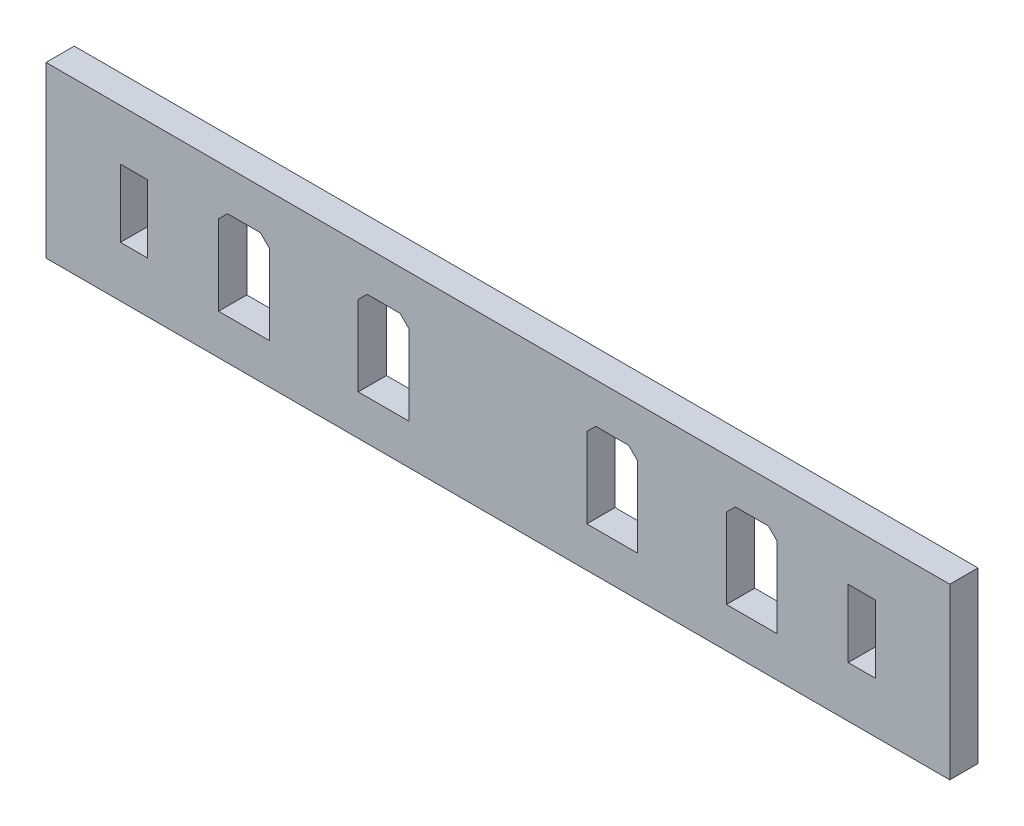
from build123d import *

# Parameters (mm, degrees)
SKETCH1_W           = 101.6
SKETCH1_H           = 19.05
BOSS_EXTRUDE1_DEPTH = 3.175
SKETCH2_W           = 3.048
SKETCH2_H           = 7.62
CUT_EXTRUDE1_DEPTH  = 104.419258966
SKETCH3_W           = 5.7
SKETCH3_H           = 10
CUT_EXTRUDE2_DEPTH  = 104.419258966
CHAMFER1_SIZE       = 1


with BuildPart() as part:
    # Sketch1 → Boss-Extrude1 (new body)
    with BuildSketch(Plane.XY):
        with Locations((50.8, 9.525)):
            Rectangle(SKETCH1_W, SKETCH1_H)
    extrude(amount=BOSS_EXTRUDE1_DEPTH)

    # Sketch2 → Cut-Extrude1 (cut, through all)
    with BuildSketch(Plane.XY.offset(3.175)):
        with Locations((9.892117884, 9.525)):
            Rectangle(SKETCH2_W, SKETCH2_H)
        with Locations((91.707882116, 9.525)):
            Rectangle(SKETCH2_W, SKETCH2_H)
    extrude(amount=-CUT_EXTRUDE1_DEPTH, mode=Mode.SUBTRACT)

    # Sketch3 → Cut-Extrude2 (cut, through all)
    with BuildSketch(Plane.XY.offset(3.175)):
        with Locations((37.95, 9.525)):
            Rectangle(SKETCH3_W, SKETCH3_H)
        with Locations((63.65, 9.525)):
            Rectangle(SKETCH3_W, SKETCH3_H)
        with Locations((79.35, 9.525)):
            Rectangle(SKETCH3_W, SKETCH3_H)
        with Locations((22.25, 9.525)):
            Rectangle(SKETCH3_W, SKETCH3_H)
    extrude(amount=-CUT_EXTRUDE2_DEPTH, mode=Mode.SUBTRACT)

    # Chamfer1
    chamfer1_edges = [part.edges().sort_by_distance(p)[0] for p in [
        (82.2, 14.525, 1.5875),
        (76.5, 14.525, 1.5875),
        (66.5, 14.525, 1.5875),
        (60.8, 14.525, 1.5875),
        (35.1, 14.525, 1.5875),
        (40.8, 14.525, 1.5875),
        (25.1, 14.525, 1.5875),
        (19.4, 14.525, 1.5875),
    ]]
    chamfer(chamfer1_edges, length=CHAMFER1_SIZE)


solid = part.part
